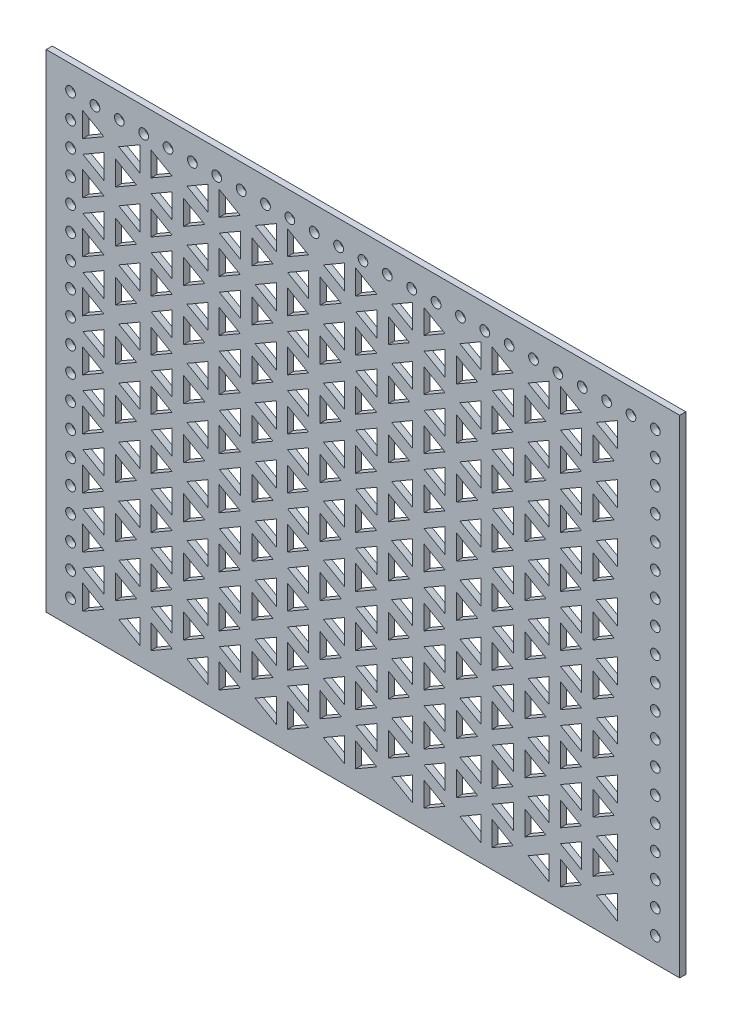
from build123d import *

# Parameters (mm, degrees)
SKETCH1_W           = 330.2
SKETCH1_H           = 254
SKETCH1_R           = 2.54
BOSS_EXTRUDE1_DEPTH = 3.175


with BuildPart() as part:
    # Sketch1 → Boss-Extrude1 (new body)
    with BuildSketch(Plane.XY):
        with Locations((73.104850904, -62.321531187)):
            Rectangle(SKETCH1_W, SKETCH1_H)
        with Locations((-79.295149096, 51.978468813)):
            Circle(SKETCH1_R, mode=Mode.SUBTRACT)
        with Locations((-66.595149096, 51.978468813)):
            Circle(SKETCH1_R, mode=Mode.SUBTRACT)
        with Locations((-53.895149096, 51.978468813)):
            Circle(SKETCH1_R, mode=Mode.SUBTRACT)
        with Locations((-41.195149096, 51.978468813)):
            Circle(SKETCH1_R, mode=Mode.SUBTRACT)
        with Locations((-28.495149096, 51.978468813)):
            Circle(SKETCH1_R, mode=Mode.SUBTRACT)
        with Locations((-15.795149096, 51.978468813)):
            Circle(SKETCH1_R, mode=Mode.SUBTRACT)
        with Locations((-3.095149096, 51.978468813)):
            Circle(SKETCH1_R, mode=Mode.SUBTRACT)
        with Locations((9.604850904, 51.978468813)):
            Circle(SKETCH1_R, mode=Mode.SUBTRACT)
        with Locations((22.304850904, 51.978468813)):
            Circle(SKETCH1_R, mode=Mode.SUBTRACT)
        with Locations((35.004850904, 51.978468813)):
            Circle(SKETCH1_R, mode=Mode.SUBTRACT)
        with Locations((47.704850904, 51.978468813)):
            Circle(SKETCH1_R, mode=Mode.SUBTRACT)
        with Locations((60.404850904, 51.978468813)):
            Circle(SKETCH1_R, mode=Mode.SUBTRACT)
        with Locations((73.104850904, 51.978468813)):
            Circle(SKETCH1_R, mode=Mode.SUBTRACT)
        with Locations((85.804850904, 51.978468813)):
            Circle(SKETCH1_R, mode=Mode.SUBTRACT)
        with Locations((98.504850904, 51.978468813)):
            Circle(SKETCH1_R, mode=Mode.SUBTRACT)
        with Locations((111.204850904, 51.978468813)):
            Circle(SKETCH1_R, mode=Mode.SUBTRACT)
        with Locations((123.904850904, 51.978468813)):
            Circle(SKETCH1_R, mode=Mode.SUBTRACT)
        with Locations((136.604850904, 51.978468813)):
            Circle(SKETCH1_R, mode=Mode.SUBTRACT)
        with Locations((149.304850904, 51.978468813)):
            Circle(SKETCH1_R, mode=Mode.SUBTRACT)
        with Locations((162.004850904, 51.978468813)):
            Circle(SKETCH1_R, mode=Mode.SUBTRACT)
        with Locations((174.704850904, 51.978468813)):
            Circle(SKETCH1_R, mode=Mode.SUBTRACT)
        with Locations((187.404850904, 51.978468813)):
            Circle(SKETCH1_R, mode=Mode.SUBTRACT)
        with Locations((200.104850904, 51.978468813)):
            Circle(SKETCH1_R, mode=Mode.SUBTRACT)
        with Locations((212.804850904, 51.978468813)):
            Circle(SKETCH1_R, mode=Mode.SUBTRACT)
        with Locations((225.504850904, 51.978468813)):
            Circle(SKETCH1_R, mode=Mode.SUBTRACT)
        with Locations((225.504850904, 39.278468813)):
            Circle(SKETCH1_R, mode=Mode.SUBTRACT)
        with Locations((225.504850904, 26.578468813)):
            Circle(SKETCH1_R, mode=Mode.SUBTRACT)
        with Locations((225.504850904, 13.878468813)):
            Circle(SKETCH1_R, mode=Mode.SUBTRACT)
        with Locations((225.504850904, 1.178468813)):
            Circle(SKETCH1_R, mode=Mode.SUBTRACT)
        with Locations((225.504850904, -11.521531187)):
            Circle(SKETCH1_R, mode=Mode.SUBTRACT)
        with Locations((225.504850904, -24.221531187)):
            Circle(SKETCH1_R, mode=Mode.SUBTRACT)
        with Locations((225.504850904, -36.921531187)):
            Circle(SKETCH1_R, mode=Mode.SUBTRACT)
        with Locations((225.504850904, -49.621531187)):
            Circle(SKETCH1_R, mode=Mode.SUBTRACT)
        with Locations((225.504850904, -62.321531187)):
            Circle(SKETCH1_R, mode=Mode.SUBTRACT)
        with Locations((225.504850904, -75.021531187)):
            Circle(SKETCH1_R, mode=Mode.SUBTRACT)
        with Locations((225.504850904, -87.721531187)):
            Circle(SKETCH1_R, mode=Mode.SUBTRACT)
        with Locations((225.504850904, -100.421531187)):
            Circle(SKETCH1_R, mode=Mode.SUBTRACT)
        with Locations((225.504850904, -113.121531187)):
            Circle(SKETCH1_R, mode=Mode.SUBTRACT)
        with Locations((225.504850904, -125.821531187)):
            Circle(SKETCH1_R, mode=Mode.SUBTRACT)
        with Locations((225.504850904, -138.521531187)):
            Circle(SKETCH1_R, mode=Mode.SUBTRACT)
        with Locations((225.504850904, -151.221531187)):
            Circle(SKETCH1_R, mode=Mode.SUBTRACT)
        with Locations((225.504850904, -163.921531187)):
            Circle(SKETCH1_R, mode=Mode.SUBTRACT)
        with Locations((225.504850904, -176.621531187)):
            Circle(SKETCH1_R, mode=Mode.SUBTRACT)
        with Locations((-79.295149096, 39.278468813)):
            Circle(SKETCH1_R, mode=Mode.SUBTRACT)
        with Locations((-79.295149096, 26.578468813)):
            Circle(SKETCH1_R, mode=Mode.SUBTRACT)
        with Locations((-79.295149096, 13.878468813)):
            Circle(SKETCH1_R, mode=Mode.SUBTRACT)
        with Locations((-79.295149096, 1.178468813)):
            Circle(SKETCH1_R, mode=Mode.SUBTRACT)
        with Locations((-79.295149096, -11.521531187)):
            Circle(SKETCH1_R, mode=Mode.SUBTRACT)
        with Locations((-79.295149096, -24.221531187)):
            Circle(SKETCH1_R, mode=Mode.SUBTRACT)
        with Locations((-79.295149096, -36.921531187)):
            Circle(SKETCH1_R, mode=Mode.SUBTRACT)
        with Locations((-79.295149096, -49.621531187)):
            Circle(SKETCH1_R, mode=Mode.SUBTRACT)
        with Locations((-79.295149096, -62.321531187)):
            Circle(SKETCH1_R, mode=Mode.SUBTRACT)
        with Locations((-79.295149096, -75.021531187)):
            Circle(SKETCH1_R, mode=Mode.SUBTRACT)
        with Locations((-79.295149096, -87.721531187)):
            Circle(SKETCH1_R, mode=Mode.SUBTRACT)
        with Locations((-79.295149096, -100.421531187)):
            Circle(SKETCH1_R, mode=Mode.SUBTRACT)
        with Locations((-79.295149096, -113.121531187)):
            Circle(SKETCH1_R, mode=Mode.SUBTRACT)
        with Locations((-79.295149096, -125.821531187)):
            Circle(SKETCH1_R, mode=Mode.SUBTRACT)
        with Locations((-79.295149096, -138.521531187)):
            Circle(SKETCH1_R, mode=Mode.SUBTRACT)
        with Locations((-79.295149096, -151.221531187)):
            Circle(SKETCH1_R, mode=Mode.SUBTRACT)
        with Locations((-79.295149096, -163.921531187)):
            Circle(SKETCH1_R, mode=Mode.SUBTRACT)
        with Locations((-79.295149096, -176.621531187)):
            Circle(SKETCH1_R, mode=Mode.SUBTRACT)
        Polygon((-61.946626468, 40.364208378), (-72.945149096, 46.714208378), (-72.945149096, 34.014208378), align=None, mode=Mode.SUBTRACT)
        Polygon((-61.886438054, 20.582398556), (-61.886438054, 33.282398556), (-72.884960682, 26.932398556), align=None, mode=Mode.SUBTRACT)
        Polygon((-44.876009044, 27.024978019), (-55.874531672, 33.374978019), (-55.874531672, 20.674978019), align=None, mode=Mode.SUBTRACT)
        Polygon((-43.205214358, 33.349858896), (-43.205214358, 46.049858896), (-54.203736986, 39.699858896), align=None, mode=Mode.SUBTRACT)
        Polygon((-26.386626468, 40.364208378), (-37.385149096, 46.714208378), (-37.385149096, 34.014208378), align=None, mode=Mode.SUBTRACT)
        Polygon((-26.326438054, 20.582398556), (-26.326438054, 33.282398556), (-37.324960682, 26.932398556), align=None, mode=Mode.SUBTRACT)
        Polygon((-9.316009044, 27.024978019), (-20.314531672, 33.374978019), (-20.314531672, 20.674978019), align=None, mode=Mode.SUBTRACT)
        Polygon((-7.645214358, 33.349858896), (-7.645214358, 46.049858896), (-18.643736986, 39.699858896), align=None, mode=Mode.SUBTRACT)
        Polygon((9.173373532, 40.364208378), (-1.825149096, 46.714208378), (-1.825149096, 34.014208378), align=None, mode=Mode.SUBTRACT)
        Polygon((9.233561946, 20.582398556), (9.233561946, 33.282398556), (-1.764960682, 26.932398556), align=None, mode=Mode.SUBTRACT)
        Polygon((26.243990956, 27.024978019), (15.245468328, 33.374978019), (15.245468328, 20.674978019), align=None, mode=Mode.SUBTRACT)
        Polygon((27.914785642, 33.349858896), (27.914785642, 46.049858896), (16.916263014, 39.699858896), align=None, mode=Mode.SUBTRACT)
        Polygon((44.733373532, 40.364208378), (33.734850904, 46.714208378), (33.734850904, 34.014208378), align=None, mode=Mode.SUBTRACT)
        Polygon((44.793561946, 20.582398556), (44.793561946, 33.282398556), (33.795039318, 26.932398556), align=None, mode=Mode.SUBTRACT)
        Polygon((61.803990956, 27.024978019), (50.805468328, 33.374978019), (50.805468328, 20.674978019), align=None, mode=Mode.SUBTRACT)
        Polygon((63.474785642, 33.349858896), (63.474785642, 46.049858896), (52.476263014, 39.699858896), align=None, mode=Mode.SUBTRACT)
        Polygon((80.293373532, 40.364208378), (69.294850904, 46.714208378), (69.294850904, 34.014208378), align=None, mode=Mode.SUBTRACT)
        Polygon((80.353561946, 20.582398556), (80.353561946, 33.282398556), (69.355039318, 26.932398556), align=None, mode=Mode.SUBTRACT)
        Polygon((97.363990956, 27.024978019), (86.365468328, 33.374978019), (86.365468328, 20.674978019), align=None, mode=Mode.SUBTRACT)
        Polygon((99.034785642, 33.349858896), (99.034785642, 46.049858896), (88.036263014, 39.699858896), align=None, mode=Mode.SUBTRACT)
        Polygon((115.853373532, 40.364208378), (104.854850904, 46.714208378), (104.854850904, 34.014208378), align=None, mode=Mode.SUBTRACT)
        Polygon((115.913561946, 20.582398556), (115.913561946, 33.282398556), (104.915039318, 26.932398556), align=None, mode=Mode.SUBTRACT)
        Polygon((132.923990956, 27.024978019), (121.925468328, 33.374978019), (121.925468328, 20.674978019), align=None, mode=Mode.SUBTRACT)
        Polygon((134.594785642, 33.349858896), (134.594785642, 46.049858896), (123.596263014, 39.699858896), align=None, mode=Mode.SUBTRACT)
        Polygon((151.413373532, 40.364208378), (140.414850904, 46.714208378), (140.414850904, 34.014208378), align=None, mode=Mode.SUBTRACT)
        Polygon((151.473561946, 20.582398556), (151.473561946, 33.282398556), (140.475039318, 26.932398556), align=None, mode=Mode.SUBTRACT)
        Polygon((168.483990956, 27.024978019), (157.485468328, 33.374978019), (157.485468328, 20.674978019), align=None, mode=Mode.SUBTRACT)
        Polygon((170.154785642, 33.349858896), (170.154785642, 46.049858896), (159.156263014, 39.699858896), align=None, mode=Mode.SUBTRACT)
        Polygon((186.973373532, 40.364208378), (175.974850904, 46.714208378), (175.974850904, 34.014208378), align=None, mode=Mode.SUBTRACT)
        Polygon((187.033561946, 20.582398556), (187.033561946, 33.282398556), (176.035039318, 26.932398556), align=None, mode=Mode.SUBTRACT)
        Polygon((204.043990956, 27.024978019), (193.045468328, 33.374978019), (193.045468328, 20.674978019), align=None, mode=Mode.SUBTRACT)
        Polygon((205.714785642, 33.349858896), (205.714785642, 46.049858896), (194.716263014, 39.699858896), align=None, mode=Mode.SUBTRACT)
        Polygon((-26.386626468, 13.694208378), (-37.385149096, 20.044208378), (-37.385149096, 7.344208378), align=None, mode=Mode.SUBTRACT)
        Polygon((-26.326438054, -6.087601444), (-26.326438054, 6.612398556), (-37.324960682, 0.262398556), align=None, mode=Mode.SUBTRACT)
        Polygon((-9.316009044, 0.354978019), (-20.314531672, 6.704978019), (-20.314531672, -5.995021981), align=None, mode=Mode.SUBTRACT)
        Polygon((-7.645214358, 6.679858896), (-7.645214358, 19.379858896), (-18.643736986, 13.029858896), align=None, mode=Mode.SUBTRACT)
        Polygon((9.173373532, 13.694208378), (-1.825149096, 20.044208378), (-1.825149096, 7.344208378), align=None, mode=Mode.SUBTRACT)
        Polygon((9.233561946, -6.087601444), (9.233561946, 6.612398556), (-1.764960682, 0.262398556), align=None, mode=Mode.SUBTRACT)
        Polygon((26.243990956, 0.354978019), (15.245468328, 6.704978019), (15.245468328, -5.995021981), align=None, mode=Mode.SUBTRACT)
        Polygon((27.914785642, 6.679858896), (27.914785642, 19.379858896), (16.916263014, 13.029858896), align=None, mode=Mode.SUBTRACT)
        Polygon((44.733373532, 13.694208378), (33.734850904, 20.044208378), (33.734850904, 7.344208378), align=None, mode=Mode.SUBTRACT)
        Polygon((44.793561946, -6.087601444), (44.793561946, 6.612398556), (33.795039318, 0.262398556), align=None, mode=Mode.SUBTRACT)
        Polygon((61.803990956, 0.354978019), (50.805468328, 6.704978019), (50.805468328, -5.995021981), align=None, mode=Mode.SUBTRACT)
        Polygon((63.474785642, 6.679858896), (63.474785642, 19.379858896), (52.476263014, 13.029858896), align=None, mode=Mode.SUBTRACT)
        Polygon((80.293373532, 13.694208378), (69.294850904, 20.044208378), (69.294850904, 7.344208378), align=None, mode=Mode.SUBTRACT)
        Polygon((80.353561946, -6.087601444), (80.353561946, 6.612398556), (69.355039318, 0.262398556), align=None, mode=Mode.SUBTRACT)
        Polygon((97.363990956, 0.354978019), (86.365468328, 6.704978019), (86.365468328, -5.995021981), align=None, mode=Mode.SUBTRACT)
        Polygon((99.034785642, 6.679858896), (99.034785642, 19.379858896), (88.036263014, 13.029858896), align=None, mode=Mode.SUBTRACT)
        Polygon((115.853373532, 13.694208378), (104.854850904, 20.044208378), (104.854850904, 7.344208378), align=None, mode=Mode.SUBTRACT)
        Polygon((115.913561946, -6.087601444), (115.913561946, 6.612398556), (104.915039318, 0.262398556), align=None, mode=Mode.SUBTRACT)
        Polygon((132.923990956, 0.354978019), (121.925468328, 6.704978019), (121.925468328, -5.995021981), align=None, mode=Mode.SUBTRACT)
        Polygon((134.594785642, 6.679858896), (134.594785642, 19.379858896), (123.596263014, 13.029858896), align=None, mode=Mode.SUBTRACT)
        Polygon((151.413373532, 13.694208378), (140.414850904, 20.044208378), (140.414850904, 7.344208378), align=None, mode=Mode.SUBTRACT)
        Polygon((151.473561946, -6.087601444), (151.473561946, 6.612398556), (140.475039318, 0.262398556), align=None, mode=Mode.SUBTRACT)
        Polygon((168.483990956, 0.354978019), (157.485468328, 6.704978019), (157.485468328, -5.995021981), align=None, mode=Mode.SUBTRACT)
        Polygon((170.154785642, 6.679858896), (170.154785642, 19.379858896), (159.156263014, 13.029858896), align=None, mode=Mode.SUBTRACT)
        Polygon((186.973373532, 13.694208378), (175.974850904, 20.044208378), (175.974850904, 7.344208378), align=None, mode=Mode.SUBTRACT)
        Polygon((187.033561946, -6.087601444), (187.033561946, 6.612398556), (176.035039318, 0.262398556), align=None, mode=Mode.SUBTRACT)
        Polygon((204.043990956, 0.354978019), (193.045468328, 6.704978019), (193.045468328, -5.995021981), align=None, mode=Mode.SUBTRACT)
        Polygon((205.714785642, 6.679858896), (205.714785642, 19.379858896), (194.716263014, 13.029858896), align=None, mode=Mode.SUBTRACT)
        Polygon((-26.386626468, -12.975791622), (-37.385149096, -6.625791622), (-37.385149096, -19.325791622), align=None, mode=Mode.SUBTRACT)
        Polygon((-26.326438054, -32.757601444), (-26.326438054, -20.057601444), (-37.324960682, -26.407601444), align=None, mode=Mode.SUBTRACT)
        Polygon((-9.316009044, -26.315021981), (-20.314531672, -19.965021981), (-20.314531672, -32.665021981), align=None, mode=Mode.SUBTRACT)
        Polygon((-7.645214358, -19.990141104), (-7.645214358, -7.290141104), (-18.643736986, -13.640141104), align=None, mode=Mode.SUBTRACT)
        Polygon((9.173373532, -12.975791622), (-1.825149096, -6.625791622), (-1.825149096, -19.325791622), align=None, mode=Mode.SUBTRACT)
        Polygon((9.233561946, -32.757601444), (9.233561946, -20.057601444), (-1.764960682, -26.407601444), align=None, mode=Mode.SUBTRACT)
        Polygon((26.243990956, -26.315021981), (15.245468328, -19.965021981), (15.245468328, -32.665021981), align=None, mode=Mode.SUBTRACT)
        Polygon((27.914785642, -19.990141104), (27.914785642, -7.290141104), (16.916263014, -13.640141104), align=None, mode=Mode.SUBTRACT)
        Polygon((44.733373532, -12.975791622), (33.734850904, -6.625791622), (33.734850904, -19.325791622), align=None, mode=Mode.SUBTRACT)
        Polygon((44.793561946, -32.757601444), (44.793561946, -20.057601444), (33.795039318, -26.407601444), align=None, mode=Mode.SUBTRACT)
        Polygon((61.803990956, -26.315021981), (50.805468328, -19.965021981), (50.805468328, -32.665021981), align=None, mode=Mode.SUBTRACT)
        Polygon((63.474785642, -19.990141104), (63.474785642, -7.290141104), (52.476263014, -13.640141104), align=None, mode=Mode.SUBTRACT)
        Polygon((80.293373532, -12.975791622), (69.294850904, -6.625791622), (69.294850904, -19.325791622), align=None, mode=Mode.SUBTRACT)
        Polygon((80.353561946, -32.757601444), (80.353561946, -20.057601444), (69.355039318, -26.407601444), align=None, mode=Mode.SUBTRACT)
        Polygon((97.363990956, -26.315021981), (86.365468328, -19.965021981), (86.365468328, -32.665021981), align=None, mode=Mode.SUBTRACT)
        Polygon((99.034785642, -19.990141104), (99.034785642, -7.290141104), (88.036263014, -13.640141104), align=None, mode=Mode.SUBTRACT)
        Polygon((115.853373532, -12.975791622), (104.854850904, -6.625791622), (104.854850904, -19.325791622), align=None, mode=Mode.SUBTRACT)
        Polygon((115.913561946, -32.757601444), (115.913561946, -20.057601444), (104.915039318, -26.407601444), align=None, mode=Mode.SUBTRACT)
        Polygon((132.923990956, -26.315021981), (121.925468328, -19.965021981), (121.925468328, -32.665021981), align=None, mode=Mode.SUBTRACT)
        Polygon((134.594785642, -19.990141104), (134.594785642, -7.290141104), (123.596263014, -13.640141104), align=None, mode=Mode.SUBTRACT)
        Polygon((151.413373532, -12.975791622), (140.414850904, -6.625791622), (140.414850904, -19.325791622), align=None, mode=Mode.SUBTRACT)
        Polygon((151.473561946, -32.757601444), (151.473561946, -20.057601444), (140.475039318, -26.407601444), align=None, mode=Mode.SUBTRACT)
        Polygon((168.483990956, -26.315021981), (157.485468328, -19.965021981), (157.485468328, -32.665021981), align=None, mode=Mode.SUBTRACT)
        Polygon((170.154785642, -19.990141104), (170.154785642, -7.290141104), (159.156263014, -13.640141104), align=None, mode=Mode.SUBTRACT)
        Polygon((186.973373532, -12.975791622), (175.974850904, -6.625791622), (175.974850904, -19.325791622), align=None, mode=Mode.SUBTRACT)
        Polygon((187.033561946, -32.757601444), (187.033561946, -20.057601444), (176.035039318, -26.407601444), align=None, mode=Mode.SUBTRACT)
        Polygon((204.043990956, -26.315021981), (193.045468328, -19.965021981), (193.045468328, -32.665021981), align=None, mode=Mode.SUBTRACT)
        Polygon((205.714785642, -19.990141104), (205.714785642, -7.290141104), (194.716263014, -13.640141104), align=None, mode=Mode.SUBTRACT)
        Polygon((-26.386626468, -39.645791622), (-37.385149096, -33.295791622), (-37.385149096, -45.995791622), align=None, mode=Mode.SUBTRACT)
        Polygon((-26.326438054, -59.427601444), (-26.326438054, -46.727601444), (-37.324960682, -53.077601444), align=None, mode=Mode.SUBTRACT)
        Polygon((-9.316009044, -52.985021981), (-20.314531672, -46.635021981), (-20.314531672, -59.335021981), align=None, mode=Mode.SUBTRACT)
        Polygon((-7.645214358, -46.660141104), (-7.645214358, -33.960141104), (-18.643736986, -40.310141104), align=None, mode=Mode.SUBTRACT)
        Polygon((9.173373532, -39.645791622), (-1.825149096, -33.295791622), (-1.825149096, -45.995791622), align=None, mode=Mode.SUBTRACT)
        Polygon((9.233561946, -59.427601444), (9.233561946, -46.727601444), (-1.764960682, -53.077601444), align=None, mode=Mode.SUBTRACT)
        Polygon((26.243990956, -52.985021981), (15.245468328, -46.635021981), (15.245468328, -59.335021981), align=None, mode=Mode.SUBTRACT)
        Polygon((27.914785642, -46.660141104), (27.914785642, -33.960141104), (16.916263014, -40.310141104), align=None, mode=Mode.SUBTRACT)
        Polygon((44.733373532, -39.645791622), (33.734850904, -33.295791622), (33.734850904, -45.995791622), align=None, mode=Mode.SUBTRACT)
        Polygon((44.793561946, -59.427601444), (44.793561946, -46.727601444), (33.795039318, -53.077601444), align=None, mode=Mode.SUBTRACT)
        Polygon((61.803990956, -52.985021981), (50.805468328, -46.635021981), (50.805468328, -59.335021981), align=None, mode=Mode.SUBTRACT)
        Polygon((63.474785642, -46.660141104), (63.474785642, -33.960141104), (52.476263014, -40.310141104), align=None, mode=Mode.SUBTRACT)
        Polygon((80.293373532, -39.645791622), (69.294850904, -33.295791622), (69.294850904, -45.995791622), align=None, mode=Mode.SUBTRACT)
        Polygon((80.353561946, -59.427601444), (80.353561946, -46.727601444), (69.355039318, -53.077601444), align=None, mode=Mode.SUBTRACT)
        Polygon((97.363990956, -52.985021981), (86.365468328, -46.635021981), (86.365468328, -59.335021981), align=None, mode=Mode.SUBTRACT)
        Polygon((99.034785642, -46.660141104), (99.034785642, -33.960141104), (88.036263014, -40.310141104), align=None, mode=Mode.SUBTRACT)
        Polygon((115.853373532, -39.645791622), (104.854850904, -33.295791622), (104.854850904, -45.995791622), align=None, mode=Mode.SUBTRACT)
        Polygon((115.913561946, -59.427601444), (115.913561946, -46.727601444), (104.915039318, -53.077601444), align=None, mode=Mode.SUBTRACT)
        Polygon((132.923990956, -52.985021981), (121.925468328, -46.635021981), (121.925468328, -59.335021981), align=None, mode=Mode.SUBTRACT)
        Polygon((134.594785642, -46.660141104), (134.594785642, -33.960141104), (123.596263014, -40.310141104), align=None, mode=Mode.SUBTRACT)
        Polygon((151.413373532, -39.645791622), (140.414850904, -33.295791622), (140.414850904, -45.995791622), align=None, mode=Mode.SUBTRACT)
        Polygon((151.473561946, -59.427601444), (151.473561946, -46.727601444), (140.475039318, -53.077601444), align=None, mode=Mode.SUBTRACT)
        Polygon((168.483990956, -52.985021981), (157.485468328, -46.635021981), (157.485468328, -59.335021981), align=None, mode=Mode.SUBTRACT)
        Polygon((170.154785642, -46.660141104), (170.154785642, -33.960141104), (159.156263014, -40.310141104), align=None, mode=Mode.SUBTRACT)
        Polygon((186.973373532, -39.645791622), (175.974850904, -33.295791622), (175.974850904, -45.995791622), align=None, mode=Mode.SUBTRACT)
        Polygon((187.033561946, -59.427601444), (187.033561946, -46.727601444), (176.035039318, -53.077601444), align=None, mode=Mode.SUBTRACT)
        Polygon((204.043990956, -52.985021981), (193.045468328, -46.635021981), (193.045468328, -59.335021981), align=None, mode=Mode.SUBTRACT)
        Polygon((205.714785642, -46.660141104), (205.714785642, -33.960141104), (194.716263014, -40.310141104), align=None, mode=Mode.SUBTRACT)
        Polygon((-26.386626468, -66.315791622), (-37.385149096, -59.965791622), (-37.385149096, -72.665791622), align=None, mode=Mode.SUBTRACT)
        Polygon((-26.326438054, -86.097601444), (-26.326438054, -73.397601444), (-37.324960682, -79.747601444), align=None, mode=Mode.SUBTRACT)
        Polygon((-9.316009044, -79.655021981), (-20.314531672, -73.305021981), (-20.314531672, -86.005021981), align=None, mode=Mode.SUBTRACT)
        Polygon((-7.645214358, -73.330141104), (-7.645214358, -60.630141104), (-18.643736986, -66.980141104), align=None, mode=Mode.SUBTRACT)
        Polygon((9.173373532, -66.315791622), (-1.825149096, -59.965791622), (-1.825149096, -72.665791622), align=None, mode=Mode.SUBTRACT)
        Polygon((9.233561946, -86.097601444), (9.233561946, -73.397601444), (-1.764960682, -79.747601444), align=None, mode=Mode.SUBTRACT)
        Polygon((26.243990956, -79.655021981), (15.245468328, -73.305021981), (15.245468328, -86.005021981), align=None, mode=Mode.SUBTRACT)
        Polygon((27.914785642, -73.330141104), (27.914785642, -60.630141104), (16.916263014, -66.980141104), align=None, mode=Mode.SUBTRACT)
        Polygon((44.733373532, -66.315791622), (33.734850904, -59.965791622), (33.734850904, -72.665791622), align=None, mode=Mode.SUBTRACT)
        Polygon((44.793561946, -86.097601444), (44.793561946, -73.397601444), (33.795039318, -79.747601444), align=None, mode=Mode.SUBTRACT)
        Polygon((61.803990956, -79.655021981), (50.805468328, -73.305021981), (50.805468328, -86.005021981), align=None, mode=Mode.SUBTRACT)
        Polygon((63.474785642, -73.330141104), (63.474785642, -60.630141104), (52.476263014, -66.980141104), align=None, mode=Mode.SUBTRACT)
        Polygon((80.293373532, -66.315791622), (69.294850904, -59.965791622), (69.294850904, -72.665791622), align=None, mode=Mode.SUBTRACT)
        Polygon((80.353561946, -86.097601444), (80.353561946, -73.397601444), (69.355039318, -79.747601444), align=None, mode=Mode.SUBTRACT)
        Polygon((97.363990956, -79.655021981), (86.365468328, -73.305021981), (86.365468328, -86.005021981), align=None, mode=Mode.SUBTRACT)
        Polygon((99.034785642, -73.330141104), (99.034785642, -60.630141104), (88.036263014, -66.980141104), align=None, mode=Mode.SUBTRACT)
        Polygon((115.853373532, -66.315791622), (104.854850904, -59.965791622), (104.854850904, -72.665791622), align=None, mode=Mode.SUBTRACT)
        Polygon((115.913561946, -86.097601444), (115.913561946, -73.397601444), (104.915039318, -79.747601444), align=None, mode=Mode.SUBTRACT)
        Polygon((132.923990956, -79.655021981), (121.925468328, -73.305021981), (121.925468328, -86.005021981), align=None, mode=Mode.SUBTRACT)
        Polygon((134.594785642, -73.330141104), (134.594785642, -60.630141104), (123.596263014, -66.980141104), align=None, mode=Mode.SUBTRACT)
        Polygon((151.413373532, -66.315791622), (140.414850904, -59.965791622), (140.414850904, -72.665791622), align=None, mode=Mode.SUBTRACT)
        Polygon((151.473561946, -86.097601444), (151.473561946, -73.397601444), (140.475039318, -79.747601444), align=None, mode=Mode.SUBTRACT)
        Polygon((168.483990956, -79.655021981), (157.485468328, -73.305021981), (157.485468328, -86.005021981), align=None, mode=Mode.SUBTRACT)
        Polygon((170.154785642, -73.330141104), (170.154785642, -60.630141104), (159.156263014, -66.980141104), align=None, mode=Mode.SUBTRACT)
        Polygon((186.973373532, -66.315791622), (175.974850904, -59.965791622), (175.974850904, -72.665791622), align=None, mode=Mode.SUBTRACT)
        Polygon((187.033561946, -86.097601444), (187.033561946, -73.397601444), (176.035039318, -79.747601444), align=None, mode=Mode.SUBTRACT)
        Polygon((204.043990956, -79.655021981), (193.045468328, -73.305021981), (193.045468328, -86.005021981), align=None, mode=Mode.SUBTRACT)
        Polygon((205.714785642, -73.330141104), (205.714785642, -60.630141104), (194.716263014, -66.980141104), align=None, mode=Mode.SUBTRACT)
        Polygon((-26.386626468, -92.985791622), (-37.385149096, -86.635791622), (-37.385149096, -99.335791622), align=None, mode=Mode.SUBTRACT)
        Polygon((-26.326438054, -112.767601444), (-26.326438054, -100.067601444), (-37.324960682, -106.417601444), align=None, mode=Mode.SUBTRACT)
        Polygon((-9.316009044, -106.325021981), (-20.314531672, -99.975021981), (-20.314531672, -112.675021981), align=None, mode=Mode.SUBTRACT)
        Polygon((-7.645214358, -100.000141104), (-7.645214358, -87.300141104), (-18.643736986, -93.650141104), align=None, mode=Mode.SUBTRACT)
        Polygon((9.173373532, -92.985791622), (-1.825149096, -86.635791622), (-1.825149096, -99.335791622), align=None, mode=Mode.SUBTRACT)
        Polygon((9.233561946, -112.767601444), (9.233561946, -100.067601444), (-1.764960682, -106.417601444), align=None, mode=Mode.SUBTRACT)
        Polygon((26.243990956, -106.325021981), (15.245468328, -99.975021981), (15.245468328, -112.675021981), align=None, mode=Mode.SUBTRACT)
        Polygon((27.914785642, -100.000141104), (27.914785642, -87.300141104), (16.916263014, -93.650141104), align=None, mode=Mode.SUBTRACT)
        Polygon((44.733373532, -92.985791622), (33.734850904, -86.635791622), (33.734850904, -99.335791622), align=None, mode=Mode.SUBTRACT)
        Polygon((44.793561946, -112.767601444), (44.793561946, -100.067601444), (33.795039318, -106.417601444), align=None, mode=Mode.SUBTRACT)
        Polygon((61.803990956, -106.325021981), (50.805468328, -99.975021981), (50.805468328, -112.675021981), align=None, mode=Mode.SUBTRACT)
        Polygon((63.474785642, -100.000141104), (63.474785642, -87.300141104), (52.476263014, -93.650141104), align=None, mode=Mode.SUBTRACT)
        Polygon((80.293373532, -92.985791622), (69.294850904, -86.635791622), (69.294850904, -99.335791622), align=None, mode=Mode.SUBTRACT)
        Polygon((80.353561946, -112.767601444), (80.353561946, -100.067601444), (69.355039318, -106.417601444), align=None, mode=Mode.SUBTRACT)
        Polygon((97.363990956, -106.325021981), (86.365468328, -99.975021981), (86.365468328, -112.675021981), align=None, mode=Mode.SUBTRACT)
        Polygon((99.034785642, -100.000141104), (99.034785642, -87.300141104), (88.036263014, -93.650141104), align=None, mode=Mode.SUBTRACT)
        Polygon((115.853373532, -92.985791622), (104.854850904, -86.635791622), (104.854850904, -99.335791622), align=None, mode=Mode.SUBTRACT)
        Polygon((115.913561946, -112.767601444), (115.913561946, -100.067601444), (104.915039318, -106.417601444), align=None, mode=Mode.SUBTRACT)
        Polygon((132.923990956, -106.325021981), (121.925468328, -99.975021981), (121.925468328, -112.675021981), align=None, mode=Mode.SUBTRACT)
        Polygon((134.594785642, -100.000141104), (134.594785642, -87.300141104), (123.596263014, -93.650141104), align=None, mode=Mode.SUBTRACT)
        Polygon((151.413373532, -92.985791622), (140.414850904, -86.635791622), (140.414850904, -99.335791622), align=None, mode=Mode.SUBTRACT)
        Polygon((151.473561946, -112.767601444), (151.473561946, -100.067601444), (140.475039318, -106.417601444), align=None, mode=Mode.SUBTRACT)
        Polygon((168.483990956, -106.325021981), (157.485468328, -99.975021981), (157.485468328, -112.675021981), align=None, mode=Mode.SUBTRACT)
        Polygon((170.154785642, -100.000141104), (170.154785642, -87.300141104), (159.156263014, -93.650141104), align=None, mode=Mode.SUBTRACT)
        Polygon((186.973373532, -92.985791622), (175.974850904, -86.635791622), (175.974850904, -99.335791622), align=None, mode=Mode.SUBTRACT)
        Polygon((187.033561946, -112.767601444), (187.033561946, -100.067601444), (176.035039318, -106.417601444), align=None, mode=Mode.SUBTRACT)
        Polygon((204.043990956, -106.325021981), (193.045468328, -99.975021981), (193.045468328, -112.675021981), align=None, mode=Mode.SUBTRACT)
        Polygon((205.714785642, -100.000141104), (205.714785642, -87.300141104), (194.716263014, -93.650141104), align=None, mode=Mode.SUBTRACT)
        Polygon((-26.386626468, -119.655791622), (-37.385149096, -113.305791622), (-37.385149096, -126.005791622), align=None, mode=Mode.SUBTRACT)
        Polygon((-26.326438054, -139.437601444), (-26.326438054, -126.737601444), (-37.324960682, -133.087601444), align=None, mode=Mode.SUBTRACT)
        Polygon((-9.316009044, -132.995021981), (-20.314531672, -126.645021981), (-20.314531672, -139.345021981), align=None, mode=Mode.SUBTRACT)
        Polygon((-7.645214358, -126.670141104), (-7.645214358, -113.970141104), (-18.643736986, -120.320141104), align=None, mode=Mode.SUBTRACT)
        Polygon((9.173373532, -119.655791622), (-1.825149096, -113.305791622), (-1.825149096, -126.005791622), align=None, mode=Mode.SUBTRACT)
        Polygon((9.233561946, -139.437601444), (9.233561946, -126.737601444), (-1.764960682, -133.087601444), align=None, mode=Mode.SUBTRACT)
        Polygon((26.243990956, -132.995021981), (15.245468328, -126.645021981), (15.245468328, -139.345021981), align=None, mode=Mode.SUBTRACT)
        Polygon((27.914785642, -126.670141104), (27.914785642, -113.970141104), (16.916263014, -120.320141104), align=None, mode=Mode.SUBTRACT)
        Polygon((44.733373532, -119.655791622), (33.734850904, -113.305791622), (33.734850904, -126.005791622), align=None, mode=Mode.SUBTRACT)
        Polygon((44.793561946, -139.437601444), (44.793561946, -126.737601444), (33.795039318, -133.087601444), align=None, mode=Mode.SUBTRACT)
        Polygon((61.803990956, -132.995021981), (50.805468328, -126.645021981), (50.805468328, -139.345021981), align=None, mode=Mode.SUBTRACT)
        Polygon((63.474785642, -126.670141104), (63.474785642, -113.970141104), (52.476263014, -120.320141104), align=None, mode=Mode.SUBTRACT)
        Polygon((80.293373532, -119.655791622), (69.294850904, -113.305791622), (69.294850904, -126.005791622), align=None, mode=Mode.SUBTRACT)
        Polygon((80.353561946, -139.437601444), (80.353561946, -126.737601444), (69.355039318, -133.087601444), align=None, mode=Mode.SUBTRACT)
        Polygon((97.363990956, -132.995021981), (86.365468328, -126.645021981), (86.365468328, -139.345021981), align=None, mode=Mode.SUBTRACT)
        Polygon((99.034785642, -126.670141104), (99.034785642, -113.970141104), (88.036263014, -120.320141104), align=None, mode=Mode.SUBTRACT)
        Polygon((115.853373532, -119.655791622), (104.854850904, -113.305791622), (104.854850904, -126.005791622), align=None, mode=Mode.SUBTRACT)
        Polygon((115.913561946, -139.437601444), (115.913561946, -126.737601444), (104.915039318, -133.087601444), align=None, mode=Mode.SUBTRACT)
        Polygon((132.923990956, -132.995021981), (121.925468328, -126.645021981), (121.925468328, -139.345021981), align=None, mode=Mode.SUBTRACT)
        Polygon((134.594785642, -126.670141104), (134.594785642, -113.970141104), (123.596263014, -120.320141104), align=None, mode=Mode.SUBTRACT)
        Polygon((151.413373532, -119.655791622), (140.414850904, -113.305791622), (140.414850904, -126.005791622), align=None, mode=Mode.SUBTRACT)
        Polygon((151.473561946, -139.437601444), (151.473561946, -126.737601444), (140.475039318, -133.087601444), align=None, mode=Mode.SUBTRACT)
        Polygon((168.483990956, -132.995021981), (157.485468328, -126.645021981), (157.485468328, -139.345021981), align=None, mode=Mode.SUBTRACT)
        Polygon((170.154785642, -126.670141104), (170.154785642, -113.970141104), (159.156263014, -120.320141104), align=None, mode=Mode.SUBTRACT)
        Polygon((186.973373532, -119.655791622), (175.974850904, -113.305791622), (175.974850904, -126.005791622), align=None, mode=Mode.SUBTRACT)
        Polygon((187.033561946, -139.437601444), (187.033561946, -126.737601444), (176.035039318, -133.087601444), align=None, mode=Mode.SUBTRACT)
        Polygon((204.043990956, -132.995021981), (193.045468328, -126.645021981), (193.045468328, -139.345021981), align=None, mode=Mode.SUBTRACT)
        Polygon((205.714785642, -126.670141104), (205.714785642, -113.970141104), (194.716263014, -120.320141104), align=None, mode=Mode.SUBTRACT)
        Polygon((-26.386626468, -146.325791622), (-37.385149096, -139.975791622), (-37.385149096, -152.675791622), align=None, mode=Mode.SUBTRACT)
        Polygon((-26.326438054, -166.107601444), (-26.326438054, -153.407601444), (-37.324960682, -159.757601444), align=None, mode=Mode.SUBTRACT)
        Polygon((-9.316009044, -159.665021981), (-20.314531672, -153.315021981), (-20.314531672, -166.015021981), align=None, mode=Mode.SUBTRACT)
        Polygon((-7.645214358, -153.340141104), (-7.645214358, -140.640141104), (-18.643736986, -146.990141104), align=None, mode=Mode.SUBTRACT)
        Polygon((9.173373532, -146.325791622), (-1.825149096, -139.975791622), (-1.825149096, -152.675791622), align=None, mode=Mode.SUBTRACT)
        Polygon((9.233561946, -166.107601444), (9.233561946, -153.407601444), (-1.764960682, -159.757601444), align=None, mode=Mode.SUBTRACT)
        Polygon((26.243990956, -159.665021981), (15.245468328, -153.315021981), (15.245468328, -166.015021981), align=None, mode=Mode.SUBTRACT)
        Polygon((27.914785642, -153.340141104), (27.914785642, -140.640141104), (16.916263014, -146.990141104), align=None, mode=Mode.SUBTRACT)
        Polygon((44.733373532, -146.325791622), (33.734850904, -139.975791622), (33.734850904, -152.675791622), align=None, mode=Mode.SUBTRACT)
        Polygon((44.793561946, -166.107601444), (44.793561946, -153.407601444), (33.795039318, -159.757601444), align=None, mode=Mode.SUBTRACT)
        Polygon((61.803990956, -159.665021981), (50.805468328, -153.315021981), (50.805468328, -166.015021981), align=None, mode=Mode.SUBTRACT)
        Polygon((63.474785642, -153.340141104), (63.474785642, -140.640141104), (52.476263014, -146.990141104), align=None, mode=Mode.SUBTRACT)
        Polygon((80.293373532, -146.325791622), (69.294850904, -139.975791622), (69.294850904, -152.675791622), align=None, mode=Mode.SUBTRACT)
        Polygon((80.353561946, -166.107601444), (80.353561946, -153.407601444), (69.355039318, -159.757601444), align=None, mode=Mode.SUBTRACT)
        Polygon((97.363990956, -159.665021981), (86.365468328, -153.315021981), (86.365468328, -166.015021981), align=None, mode=Mode.SUBTRACT)
        Polygon((99.034785642, -153.340141104), (99.034785642, -140.640141104), (88.036263014, -146.990141104), align=None, mode=Mode.SUBTRACT)
        Polygon((115.853373532, -146.325791622), (104.854850904, -139.975791622), (104.854850904, -152.675791622), align=None, mode=Mode.SUBTRACT)
        Polygon((115.913561946, -166.107601444), (115.913561946, -153.407601444), (104.915039318, -159.757601444), align=None, mode=Mode.SUBTRACT)
        Polygon((132.923990956, -159.665021981), (121.925468328, -153.315021981), (121.925468328, -166.015021981), align=None, mode=Mode.SUBTRACT)
        Polygon((134.594785642, -153.340141104), (134.594785642, -140.640141104), (123.596263014, -146.990141104), align=None, mode=Mode.SUBTRACT)
        Polygon((151.413373532, -146.325791622), (140.414850904, -139.975791622), (140.414850904, -152.675791622), align=None, mode=Mode.SUBTRACT)
        Polygon((151.473561946, -166.107601444), (151.473561946, -153.407601444), (140.475039318, -159.757601444), align=None, mode=Mode.SUBTRACT)
        Polygon((168.483990956, -159.665021981), (157.485468328, -153.315021981), (157.485468328, -166.015021981), align=None, mode=Mode.SUBTRACT)
        Polygon((170.154785642, -153.340141104), (170.154785642, -140.640141104), (159.156263014, -146.990141104), align=None, mode=Mode.SUBTRACT)
        Polygon((186.973373532, -146.325791622), (175.974850904, -139.975791622), (175.974850904, -152.675791622), align=None, mode=Mode.SUBTRACT)
        Polygon((187.033561946, -166.107601444), (187.033561946, -153.407601444), (176.035039318, -159.757601444), align=None, mode=Mode.SUBTRACT)
        Polygon((204.043990956, -159.665021981), (193.045468328, -153.315021981), (193.045468328, -166.015021981), align=None, mode=Mode.SUBTRACT)
        Polygon((205.714785642, -153.340141104), (205.714785642, -140.640141104), (194.716263014, -146.990141104), align=None, mode=Mode.SUBTRACT)
        Polygon((-26.386626468, -172.995791622), (-37.385149096, -166.645791622), (-37.385149096, -179.345791622), align=None, mode=Mode.SUBTRACT)
        Polygon((-7.645214358, -180.010141104), (-7.645214358, -167.310141104), (-18.643736986, -173.660141104), align=None, mode=Mode.SUBTRACT)
        Polygon((9.173373532, -172.995791622), (-1.825149096, -166.645791622), (-1.825149096, -179.345791622), align=None, mode=Mode.SUBTRACT)
        Polygon((27.914785642, -180.010141104), (27.914785642, -167.310141104), (16.916263014, -173.660141104), align=None, mode=Mode.SUBTRACT)
        Polygon((44.733373532, -172.995791622), (33.734850904, -166.645791622), (33.734850904, -179.345791622), align=None, mode=Mode.SUBTRACT)
        Polygon((63.474785642, -180.010141104), (63.474785642, -167.310141104), (52.476263014, -173.660141104), align=None, mode=Mode.SUBTRACT)
        Polygon((80.293373532, -172.995791622), (69.294850904, -166.645791622), (69.294850904, -179.345791622), align=None, mode=Mode.SUBTRACT)
        Polygon((99.034785642, -180.010141104), (99.034785642, -167.310141104), (88.036263014, -173.660141104), align=None, mode=Mode.SUBTRACT)
        Polygon((115.853373532, -172.995791622), (104.854850904, -166.645791622), (104.854850904, -179.345791622), align=None, mode=Mode.SUBTRACT)
        Polygon((134.594785642, -180.010141104), (134.594785642, -167.310141104), (123.596263014, -173.660141104), align=None, mode=Mode.SUBTRACT)
        Polygon((151.413373532, -172.995791622), (140.414850904, -166.645791622), (140.414850904, -179.345791622), align=None, mode=Mode.SUBTRACT)
        Polygon((170.154785642, -180.010141104), (170.154785642, -167.310141104), (159.156263014, -173.660141104), align=None, mode=Mode.SUBTRACT)
        Polygon((186.973373532, -172.995791622), (175.974850904, -166.645791622), (175.974850904, -179.345791622), align=None, mode=Mode.SUBTRACT)
        Polygon((205.714785642, -180.010141104), (205.714785642, -167.310141104), (194.716263014, -173.660141104), align=None, mode=Mode.SUBTRACT)
        Polygon((-61.946626468, 13.694208378), (-72.945149096, 20.044208378), (-72.945149096, 7.344208378), align=None, mode=Mode.SUBTRACT)
        Polygon((-61.886438054, -6.087601444), (-61.886438054, 6.612398556), (-72.884960682, 0.262398556), align=None, mode=Mode.SUBTRACT)
        Polygon((-44.876009044, 0.354978019), (-55.874531672, 6.704978019), (-55.874531672, -5.995021981), align=None, mode=Mode.SUBTRACT)
        Polygon((-43.205214358, 6.679858896), (-43.205214358, 19.379858896), (-54.203736986, 13.029858896), align=None, mode=Mode.SUBTRACT)
        Polygon((-61.946626468, -12.975791622), (-72.945149096, -6.625791622), (-72.945149096, -19.325791622), align=None, mode=Mode.SUBTRACT)
        Polygon((-61.886438054, -32.757601444), (-61.886438054, -20.057601444), (-72.884960682, -26.407601444), align=None, mode=Mode.SUBTRACT)
        Polygon((-44.876009044, -26.315021981), (-55.874531672, -19.965021981), (-55.874531672, -32.665021981), align=None, mode=Mode.SUBTRACT)
        Polygon((-43.205214358, -19.990141104), (-43.205214358, -7.290141104), (-54.203736986, -13.640141104), align=None, mode=Mode.SUBTRACT)
        Polygon((-61.946626468, -39.645791622), (-72.945149096, -33.295791622), (-72.945149096, -45.995791622), align=None, mode=Mode.SUBTRACT)
        Polygon((-61.886438054, -59.427601444), (-61.886438054, -46.727601444), (-72.884960682, -53.077601444), align=None, mode=Mode.SUBTRACT)
        Polygon((-44.876009044, -52.985021981), (-55.874531672, -46.635021981), (-55.874531672, -59.335021981), align=None, mode=Mode.SUBTRACT)
        Polygon((-43.205214358, -46.660141104), (-43.205214358, -33.960141104), (-54.203736986, -40.310141104), align=None, mode=Mode.SUBTRACT)
        Polygon((-61.946626468, -66.315791622), (-72.945149096, -59.965791622), (-72.945149096, -72.665791622), align=None, mode=Mode.SUBTRACT)
        Polygon((-61.886438054, -86.097601444), (-61.886438054, -73.397601444), (-72.884960682, -79.747601444), align=None, mode=Mode.SUBTRACT)
        Polygon((-44.876009044, -79.655021981), (-55.874531672, -73.305021981), (-55.874531672, -86.005021981), align=None, mode=Mode.SUBTRACT)
        Polygon((-43.205214358, -73.330141104), (-43.205214358, -60.630141104), (-54.203736986, -66.980141104), align=None, mode=Mode.SUBTRACT)
        Polygon((-61.946626468, -92.985791622), (-72.945149096, -86.635791622), (-72.945149096, -99.335791622), align=None, mode=Mode.SUBTRACT)
        Polygon((-61.886438054, -112.767601444), (-61.886438054, -100.067601444), (-72.884960682, -106.417601444), align=None, mode=Mode.SUBTRACT)
        Polygon((-44.876009044, -106.325021981), (-55.874531672, -99.975021981), (-55.874531672, -112.675021981), align=None, mode=Mode.SUBTRACT)
        Polygon((-43.205214358, -100.000141104), (-43.205214358, -87.300141104), (-54.203736986, -93.650141104), align=None, mode=Mode.SUBTRACT)
        Polygon((-61.946626468, -119.655791622), (-72.945149096, -113.305791622), (-72.945149096, -126.005791622), align=None, mode=Mode.SUBTRACT)
        Polygon((-61.886438054, -139.437601444), (-61.886438054, -126.737601444), (-72.884960682, -133.087601444), align=None, mode=Mode.SUBTRACT)
        Polygon((-44.876009044, -132.995021981), (-55.874531672, -126.645021981), (-55.874531672, -139.345021981), align=None, mode=Mode.SUBTRACT)
        Polygon((-43.205214358, -126.670141104), (-43.205214358, -113.970141104), (-54.203736986, -120.320141104), align=None, mode=Mode.SUBTRACT)
        Polygon((-61.946626468, -146.325791622), (-72.945149096, -139.975791622), (-72.945149096, -152.675791622), align=None, mode=Mode.SUBTRACT)
        Polygon((-61.886438054, -166.107601444), (-61.886438054, -153.407601444), (-72.884960682, -159.757601444), align=None, mode=Mode.SUBTRACT)
        Polygon((-44.876009044, -159.665021981), (-55.874531672, -153.315021981), (-55.874531672, -166.015021981), align=None, mode=Mode.SUBTRACT)
        Polygon((-43.205214358, -153.340141104), (-43.205214358, -140.640141104), (-54.203736986, -146.990141104), align=None, mode=Mode.SUBTRACT)
        Polygon((-61.946626468, -172.995791622), (-72.945149096, -166.645791622), (-72.945149096, -179.345791622), align=None, mode=Mode.SUBTRACT)
        Polygon((-43.205214358, -180.010141104), (-43.205214358, -167.310141104), (-54.203736986, -173.660141104), align=None, mode=Mode.SUBTRACT)
    extrude(amount=BOSS_EXTRUDE1_DEPTH)


solid = part.part
